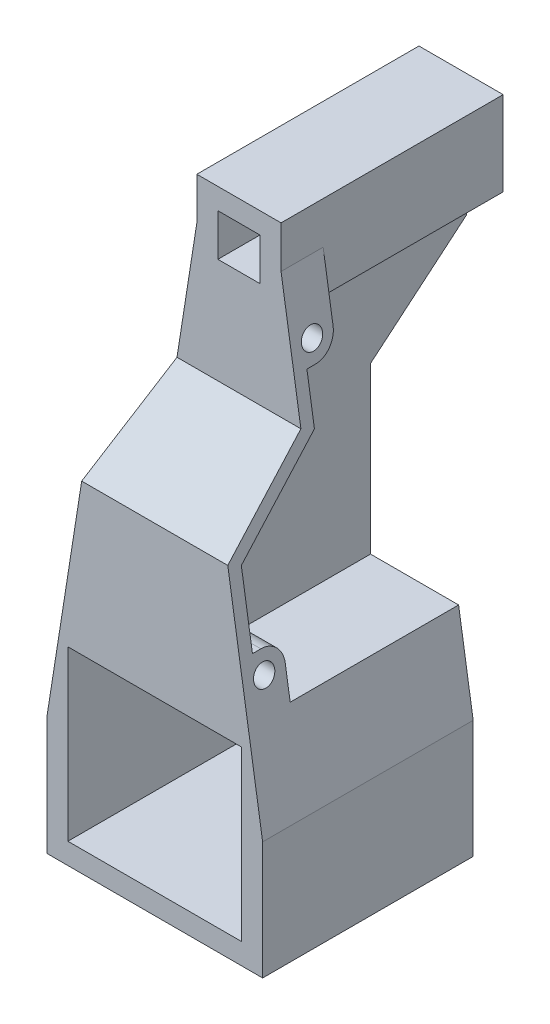
from build123d import *

# Parameters (mm, degrees)
SKETCH1_W                = 40
SKETCH1_H                = 40
SKETCH1_W_2              = 20
SKETCH1_H_2              = 20
BOSS_EXTRUDE1_DEPTH      = 105.5
SKETCH2_W                = 102.5
SKETCH2_H                = 100
SKETCH2_W_2              = 82.5
SKETCH2_H_2              = 80
BOSS_EXTRUDE2_DEPTH      = 100
EXTRUDE_THIN1_DEPTH      = 158
EXTRUDE_THIN1_DEPTH_BACK = 166
RIB8_START               = -2.5
RIB8_DEPTH               = 5
CUT_EXTRUDE2_DEPTH       = 338.270292199
SKETCH2_2_W              = 82.5
SKETCH2_2_H              = 80
CUT_EXTRUDE3_DEPTH       = 299.029885246
SKETCH1_2_W              = 20
SKETCH1_2_H              = 20
CUT_EXTRUDE4_DEPTH       = 299.029885246
BOSS_EXTRUDE3_REACH      = 300.03
SKETCH7_R                = 5
BOSS_EXTRUDE4_REACH      = 300.03
CUT_EXTRUDE6_DEPTH       = 299.029885246
CUT_EXTRUDE6_DEPTH_BACK  = 299.029885246
SKETCH7_4_R              = 5
BOSS_EXTRUDE5_DEPTH      = 14


# Read off the part's stored shape, not the designer's step: Rib8
with BuildPart() as part:
    # Sketch1 → Boss-Extrude1 (new body)
    with BuildSketch(Plane.XY):
        Rectangle(SKETCH1_W, SKETCH1_H)
        Rectangle(SKETCH1_W_2, SKETCH1_H_2, mode=Mode.SUBTRACT)
    extrude(amount=BOSS_EXTRUDE1_DEPTH)



with BuildPart() as body_2:
    # Sketch2 → Boss-Extrude2 (new body)
    with BuildSketch(Plane.XY.offset(145.5)):
        with Locations((0, -205)):
            Rectangle(SKETCH2_W, SKETCH2_H)
        with Locations((0, -205)):
            Rectangle(SKETCH2_W_2, SKETCH2_H_2, mode=Mode.SUBTRACT)
    extrude(amount=-BOSS_EXTRUDE2_DEPTH)


with BuildPart() as part_1:
    add(part.part)

    add(body_2.part)  # Extrude-Thin1 merges body 2
    # Sketch3 → Extrude-Thin1 (add, two sides: drawn at the far end of the back side and taken through both)
    with BuildSketch(Plane(origin=(0, 0, 0), x_dir=(0, 0, -1), z_dir=(1, 0, 0)).offset(-EXTRUDE_THIN1_DEPTH_BACK)):
        Polygon((-105.5, 20), (-105.5, 0), (-105.5, -60), (-145.5, -93.563985247), (-145.5, -255), (-139.5, -255), (-139.5, -96.361831196), (-99.5, -62.797845949), (-99.5, 0), (-99.5, 20), align=None)
    extrude(amount=EXTRUDE_THIN1_DEPTH + EXTRUDE_THIN1_DEPTH_BACK)

    # Rib8 outline → Rib8 (add)
    with BuildSketch(Plane.YZ.offset(RIB8_START)):
        Polygon((-38.377112489, 0), (-20, 0), (-20, 99.5), (-62.797845949, 99.5), (-96.361831196, 139.5), (-155, 139.5), (-155, 45.5), (-76.556145708, 45.5), align=None)
    extrude(amount=RIB8_DEPTH)

    # Sketch6 → Cut-Extrude2 (cut, through all)
    with BuildSketch(Plane.XY.offset(145.5)):
        Polygon((20, 20), (20, 0), (51.25, -199), (51.25, -255), (158, -255), (158, 20), align=None)
        Polygon((-51.25, -255), (-158, -255), (-166, -255), (-166, 20), (-158, 20), (-20, 20), (-20, 0), (-51.25, -199), align=None)
    extrude(amount=-CUT_EXTRUDE2_DEPTH, mode=Mode.SUBTRACT)

    # Sketch2<2> → Cut-Extrude3 (cut, through all)
    with BuildSketch(Plane.XY.offset(145.5)):
        with Locations((0, -205)):
            Rectangle(SKETCH2_2_W, SKETCH2_2_H)
    extrude(amount=-CUT_EXTRUDE3_DEPTH, mode=Mode.SUBTRACT)

    # Sketch1<2> → Cut-Extrude4 (cut, through all)
    with BuildSketch(Plane.XY):
        Rectangle(SKETCH1_2_W, SKETCH1_2_H)
    extrude(amount=CUT_EXTRUDE4_DEPTH, mode=Mode.SUBTRACT)

    # Boss-Extrude3: up to this plane
    boss_extrude3_end = Plane(origin=(-20, 0, 0), z_dir=(-0.9878934335848292, 0.15513401909309493, 0))
    # Sketch7 → Boss-Extrude3 (add, up to the surface)
    with BuildSketch(Plane(origin=(0, 0, 0), x_dir=(0, 0, -1), z_dir=(1, 0, 0)), mode=Mode.PRIVATE) as boss_extrude3_sk1:
        with BuildLine():
            Line((-145.5, -165), (-125.5, -165))
            Line((-125.5, -165), (-125.5, -140))
            ThreePointArc((-125.5, -140), (-128.428932188, -132.928932188), (-135.5, -130))
            Line((-135.5, -130), (-145.5, -130))
            Line((-145.5, -130), (-145.5, -165))
        make_face()
        with Locations((-135.5, -140)):
            Circle(SKETCH7_R, mode=Mode.SUBTRACT)
    boss_extrude3_tool1 = split(extrude(boss_extrude3_sk1.sketch, amount=-BOSS_EXTRUDE3_REACH, mode=Mode.PRIVATE), bisect_by=boss_extrude3_end, keep=Keep.BOTH, mode=Mode.PRIVATE)
    add(boss_extrude3_tool1.solids().sort_by_distance((0, -149.027778, 135.777778))[0])
    # Sketch7 → Boss-Extrude3 (add, up to the surface)
    with BuildSketch(Plane(origin=(0, 0, 0), x_dir=(0, 0, -1), z_dir=(1, 0, 0)), mode=Mode.PRIVATE) as boss_extrude3_sk2:
        with BuildLine():
            Line((-105.5, -10), (-85.5, -10))
            Line((-85.5, -10), (-85.5, -30))
            ThreePointArc((-85.5, -30), (-88.428932188, -37.071067812), (-95.5, -40))
            Line((-95.5, -40), (-105.5, -40))
            Line((-105.5, -40), (-105.5, -10))
        make_face()
        with Locations((-95.5, -30)):
            Circle(SKETCH7_R, mode=Mode.SUBTRACT)
    boss_extrude3_tool2 = split(extrude(boss_extrude3_sk2.sketch, amount=-BOSS_EXTRUDE3_REACH, mode=Mode.PRIVATE), bisect_by=boss_extrude3_end, keep=Keep.BOTH, mode=Mode.PRIVATE)
    add(boss_extrude3_tool2.solids().sort_by_distance((0, -23.666667, 95.833333))[0])

    # Boss-Extrude4: up to this plane
    boss_extrude4_end = Plane(origin=(20, 0, 0), z_dir=(-0.9878934335848292, -0.15513401909309524, 0))
    # Sketch7<2> → Boss-Extrude4 (add, up to the surface)
    with BuildSketch(Plane(origin=(0, 0, 0), x_dir=(0, 0, -1), z_dir=(1, 0, 0)), mode=Mode.PRIVATE) as boss_extrude4_sk1:
        with BuildLine():
            Line((-145.5, -165), (-125.5, -165))
            Line((-125.5, -165), (-125.5, -140))
            ThreePointArc((-125.5, -140), (-128.428932188, -132.928932188), (-135.5, -130))
            Line((-135.5, -130), (-145.5, -130))
            Line((-145.5, -130), (-145.5, -165))
        make_face()
    boss_extrude4_tool1 = split(extrude(boss_extrude4_sk1.sketch, amount=BOSS_EXTRUDE4_REACH, mode=Mode.PRIVATE), bisect_by=boss_extrude4_end, keep=Keep.BOTH, mode=Mode.PRIVATE)
    add(boss_extrude4_tool1.solids().sort_by_distance((0, -147.982828, 135.745625))[0])
    # Sketch7<2> → Boss-Extrude4 (add, up to the surface)
    with BuildSketch(Plane(origin=(0, 0, 0), x_dir=(0, 0, -1), z_dir=(1, 0, 0)), mode=Mode.PRIVATE) as boss_extrude4_sk2:
        with BuildLine():
            Line((-105.5, -10), (-85.5, -10))
            Line((-85.5, -10), (-85.5, -30))
            ThreePointArc((-85.5, -30), (-88.428932188, -37.071067812), (-95.5, -40))
            Line((-95.5, -40), (-105.5, -40))
            Line((-105.5, -40), (-105.5, -10))
        make_face()
    boss_extrude4_tool2 = split(extrude(boss_extrude4_sk2.sketch, amount=BOSS_EXTRUDE4_REACH, mode=Mode.PRIVATE), bisect_by=boss_extrude4_end, keep=Keep.BOTH, mode=Mode.PRIVATE)
    add(boss_extrude4_tool2.solids().sort_by_distance((0, -24.52645, 95.788082))[0])

    # Sketch7<4> → Cut-Extrude6 (cut, two sides: drawn at the far end of the back side and taken through both)
    with BuildSketch(Plane(origin=(0, 0, 0), x_dir=(0, 0, -1), z_dir=(1, 0, 0)).offset(-CUT_EXTRUDE6_DEPTH_BACK)):
        with Locations(Location((-135.5, -140, 0), (0, 0, 90))):
            Circle(SKETCH7_4_R)
        with Locations(Location((-95.5, -30, 0), (0, 0, 90))):
            Circle(SKETCH7_4_R)
    extrude(amount=CUT_EXTRUDE6_DEPTH + CUT_EXTRUDE6_DEPTH_BACK, mode=Mode.SUBTRACT)

    # Sketch8 → Boss-Extrude5 (add)
    with BuildSketch(Plane(origin=(0, 0, 99.5), x_dir=(-1, 0, 0), z_dir=(0, 0, -1))):
        Polygon((20, 0), (20, -10), (21.570351759, -10), align=None)
        Polygon((-20, 0), (-21.570351759, -10), (-20, -10), align=None)
    extrude(amount=BOSS_EXTRUDE5_DEPTH)


solid = part_1.part
